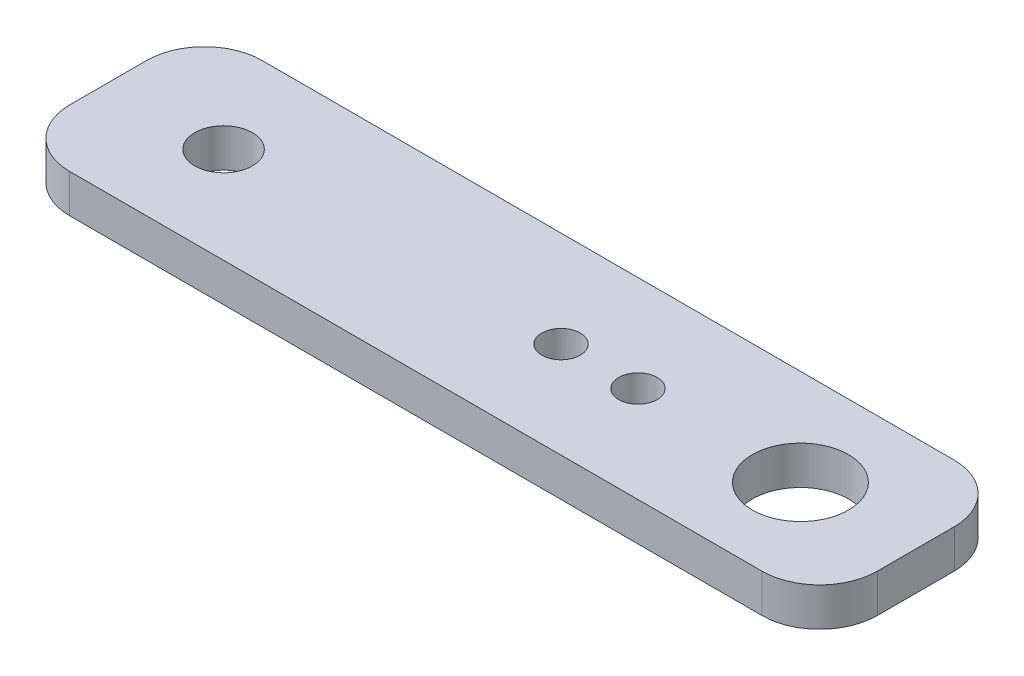
from build123d import *

# Parameters (mm, degrees)
SKETCH1_W             = 42
SKETCH1_H             = 10
BOSS_EXTRUDE1_DEPTH   = 2
F_5_0MM_DOWEL_HOLE1_D = 5
F_3_0MM_DOWEL_HOLE1_D = 3
SKETCH2_R             = 1
CUT_EXTRUDE1_DEPTH    = 3
FILLET1_R             = 3


with BuildPart() as part:
    # Sketch1 → Boss-Extrude1 (new body)
    with BuildSketch(Plane(origin=(0, 0, 0), x_dir=(1, 0, 0), z_dir=(0, 1, 0))):
        Rectangle(SKETCH1_W, SKETCH1_H)
    extrude(amount=BOSS_EXTRUDE1_DEPTH)

    # Ø5.0mm Dowel Hole1 (through all)
    with Locations(Plane(origin=(0, 2, 0), x_dir=(1, 0, 0), z_dir=(0, 1, 0))):
        with Locations((15, 0)):
            Hole(F_5_0MM_DOWEL_HOLE1_D / 2)

    # Ø3.0mm Dowel Hole1 (through all)
    with Locations(Plane(origin=(0, 2, 0), x_dir=(1, 0, 0), z_dir=(0, 1, 0))):
        with Locations((-15, 0)):
            Hole(F_3_0MM_DOWEL_HOLE1_D / 2)

    # Sketch2 → Cut-Extrude1 (cut)
    with BuildSketch(Plane(origin=(0, 2, 0), x_dir=(1, 0, 0), z_dir=(0, 1, 0))):
        with Locations((6.55, 0)):
            Circle(SKETCH2_R)
        with Locations((2.55, 0)):
            Circle(SKETCH2_R)
    extrude(amount=-CUT_EXTRUDE1_DEPTH, mode=Mode.SUBTRACT)

    # Fillet1
    fillet1_edges = [part.edges().sort_by_distance(p)[0] for p in [
        (21, 1, 5),
        (21, 1, -5),
        (-21, 1, -5),
        (-21, 1, 5),
    ]]
    fillet(fillet1_edges, radius=FILLET1_R)


solid = part.part
